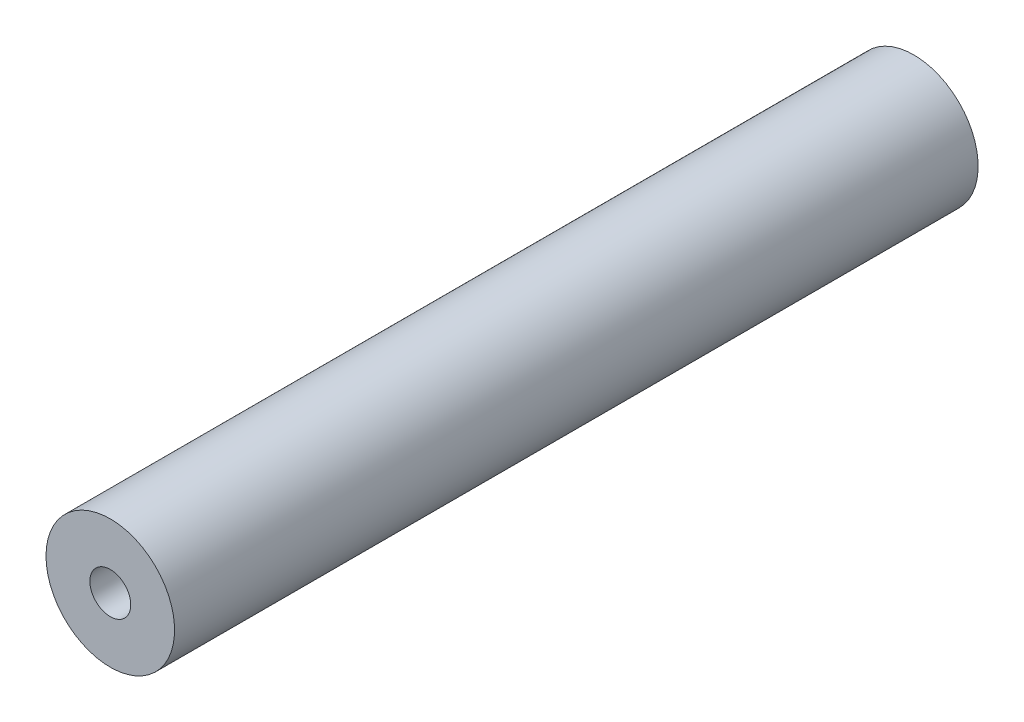
from build123d import *

# Parameters (mm, degrees)
SKETCH1_R                            = 6.35
BOSS_EXTRUDE1_DEPTH                  = 39.6875
F_10_32_TAPPED_HOLE1_D               = 4.0386
F_10_32_TAPPED_HOLE1_DEPTH           = 12.02944
F_10_32_TAPPED_HOLE1_TIP             = 1.213317848
F_10_32_TAPPED_HOLE1_ON_FACE_2_D     = 4.0386
F_10_32_TAPPED_HOLE1_ON_FACE_2_DEPTH = 12.02944
F_10_32_TAPPED_HOLE1_ON_FACE_2_TIP   = 1.213317848


with BuildPart() as part:
    # Sketch1 → Boss-Extrude1 (new, symmetric)
    with BuildSketch(Plane.XY):
        Circle(SKETCH1_R)
    extrude(amount=BOSS_EXTRUDE1_DEPTH, both=True)

    # #10-32 Tapped Hole1
    with Locations(Plane(origin=(0, 0, -39.6875), x_dir=(-1, 0, 0), z_dir=(0, 0, -1))):
        with Locations((0, 0)):
            Hole(F_10_32_TAPPED_HOLE1_D / 2, depth=F_10_32_TAPPED_HOLE1_DEPTH)
            with Locations((0, 0, -(F_10_32_TAPPED_HOLE1_DEPTH + F_10_32_TAPPED_HOLE1_TIP / 2))):  # 118° drill point
                Cone(0, F_10_32_TAPPED_HOLE1_D / 2, F_10_32_TAPPED_HOLE1_TIP, mode=Mode.SUBTRACT)

    # #10-32 Tapped Hole1 on face 2
    with Locations(Plane.XY.offset(39.6875)):
        with Locations((0, 0)):
            Hole(F_10_32_TAPPED_HOLE1_ON_FACE_2_D / 2, depth=F_10_32_TAPPED_HOLE1_ON_FACE_2_DEPTH)
            with Locations((0, 0, -(F_10_32_TAPPED_HOLE1_ON_FACE_2_DEPTH + F_10_32_TAPPED_HOLE1_ON_FACE_2_TIP / 2))):  # 118° drill point
                Cone(0, F_10_32_TAPPED_HOLE1_ON_FACE_2_D / 2, F_10_32_TAPPED_HOLE1_ON_FACE_2_TIP, mode=Mode.SUBTRACT)


solid = part.part
